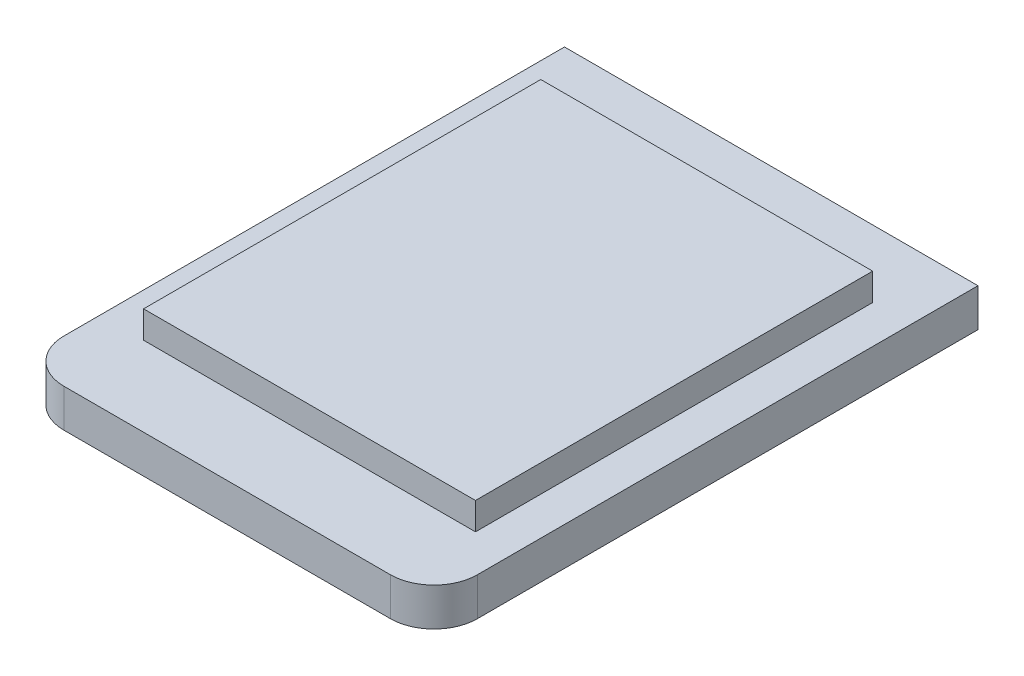
from build123d import *

# Parameters (mm, degrees)
SKETCH1_W           = 76
SKETCH1_H           = 100
BOSS_EXTRUDE1_DEPTH = 7
FILLET1_R           = 8
SKETCH2_W           = 61
SKETCH2_H           = 73
BOSS_EXTRUDE2_DEPTH = 5


with BuildPart() as part:
    # Sketch1 → Boss-Extrude1 (new body)
    with BuildSketch(Plane(origin=(0, 0, 0), x_dir=(1, 0, 0), z_dir=(0, 1, 0))):
        with Locations((38, 50)):
            Rectangle(SKETCH1_W, SKETCH1_H)
    extrude(amount=BOSS_EXTRUDE1_DEPTH)

    # Fillet1
    fillet1_edges = [part.edges().sort_by_distance(p)[0] for p in [
        (76, 3.5, 0),
        (0, 3.5, 0),
    ]]
    fillet(fillet1_edges, radius=FILLET1_R)

    # Sketch2 → Boss-Extrude2 (add)
    with BuildSketch(Plane(origin=(0, 7, 0), x_dir=(1, 0, 0), z_dir=(0, 1, 0))):
        with Locations((38.5, 51.140610309)):
            Rectangle(SKETCH2_W, SKETCH2_H)
    extrude(amount=BOSS_EXTRUDE2_DEPTH)


solid = part.part
